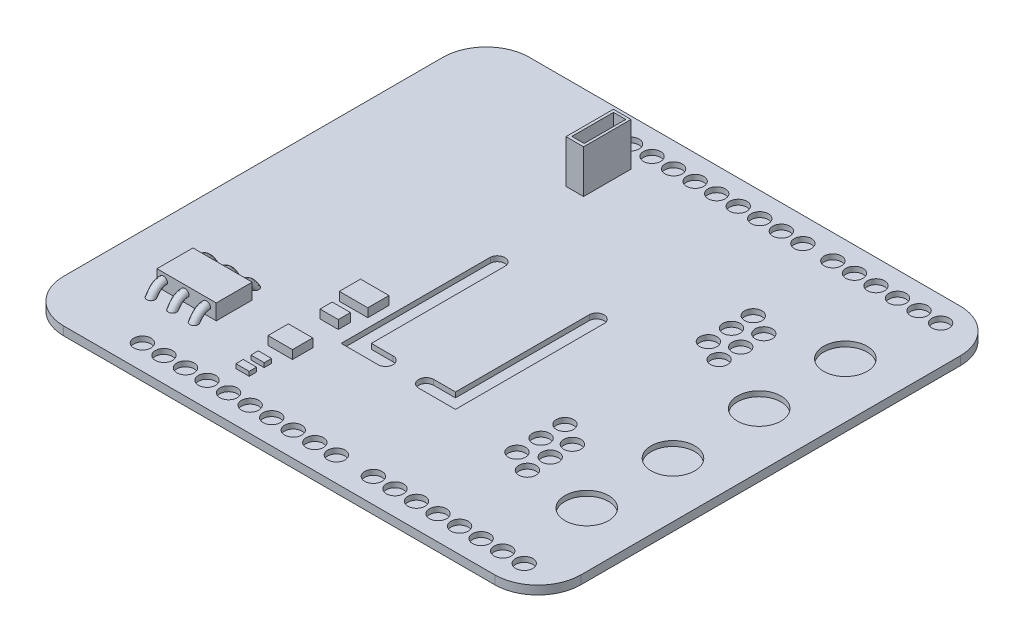
from build123d import *

# Parameters (mm, degrees)
BOSS_EXTRU_1_DEPTH                   = 1
ESQUISSE2_R                          = 1
ENL_V_MAT_EXTRU_1_DEPTH              = 0.6
R_P_TITION_LIN_AIRE1_COUNT           = 6
R_P_TITION_LIN_AIRE1_PITCH           = 2.5
ESQUISSE3_R                          = 1
ENL_V_MAT_EXTRU_2_DEPTH              = 0.6
R_P_TITION_LIN_AIRE2_COUNT           = 10
R_P_TITION_LIN_AIRE2_PITCH           = 2.5
ESQUISSE4_R                          = 1
ENL_V_MAT_EXTRU_3_DEPTH              = 0.6
R_P_TITION_LIN_AIRE3_COUNT           = 8
R_P_TITION_LIN_AIRE3_PITCH           = 2.5
ESQUISSE5_R                          = 1
ENL_V_MAT_EXTRU_4_DEPTH              = 0.6
R_P_TITION_LIN_AIRE4_COUNT           = 10
R_P_TITION_LIN_AIRE4_PITCH           = 2.5
ESQUISSE6_R                          = 2.528412427
ENL_V_MAT_EXTRU_5_DEPTH              = 0.6
R_P_TITION_LIN_AIRE5_COUNT           = 4
R_P_TITION_LIN_AIRE5_PITCH           = 10
ESQUISSE7_R                          = 1
ENL_V_MAT_EXTRU_6_DEPTH              = 0.6
ENL_V_MAT_EXTRU_7_DEPTH              = 0.6
ESQUISSE13_W                         = 2.040769276
ESQUISSE13_H                         = 5.500333113
BOSS_EXTRU_3_DEPTH                   = 5
ESQUISSE14_W                         = 1.424470163
ESQUISSE14_H                         = 4.828317201
ENL_V_MAT_EXTRU_9_DEPTH              = 3
ESQUISSE15_W                         = 6.877327247
ESQUISSE15_H                         = 4.174208242
BOSS_EXTRU_4_DEPTH                   = 1.8
ESQUISSE16_R                         = 0.483585673
R_P_TITION_LIN_AIRE6_COPY_1_SKETCH_R = 0.483585673
R_P_TITION_LIN_AIRE6_COPY_2_SKETCH_R = 0.483585673
R_P_TITION_LIN_AIRE6_COPY_3_SKETCH_R = 0.483585673
R_P_TITION_LIN_AIRE6_COPY_4_SKETCH_R = 0.483585673
ESQUISSE18_W                         = 1.537860489
ESQUISSE18_H                         = 0.85
ESQUISSE18_H_2                       = 0.847473853
BOSS_EXTRU_5_DEPTH                   = 0.5
ESQUISSE19_W                         = 2.827092101
ESQUISSE19_H                         = 2.356707552
BOSS_EXTRU_6_DEPTH                   = 1
ESQUISSE20_W                         = 2.113285246
ESQUISSE20_H                         = 1.410216863
ESQUISSE20_W_2                       = 3.299642183
ESQUISSE20_H_2                       = 2.46116146
BOSS_EXTRU_7_DEPTH                   = 1


with BuildPart() as part:
    # Esquisse1 → Boss.-Extru.1 (new body)
    with BuildSketch(Plane(origin=(0, 0, 0), x_dir=(1, 0, 0), z_dir=(0, 1, 0))):
        with BuildLine():
            Line((5, 0), (55, 0))
            ThreePointArc((55, 0), (58.535533906, 1.464466094), (60, 5))
            Line((60, 5), (60, 49))
            ThreePointArc((60, 49), (58.535533906, 52.535533906), (55, 54))
            Line((55, 54), (5, 54))
            ThreePointArc((5, 54), (1.464466094, 52.535533906), (0, 49))
            Line((0, 49), (0, 5))
            ThreePointArc((0, 5), (1.464466094, 1.464466094), (5, 0))
        make_face()
    extrude(amount=BOSS_EXTRU_1_DEPTH)

    # Esquisse2 → Enlèv. mat.-Extru.1 (cut)
    with BuildSketch(Plane(origin=(0, 1, 0), x_dir=(1, 0, 0), z_dir=(0, 1, 0))):
        with Locations((55.569344421, 51.151890883)):
            Circle(ESQUISSE2_R)
    enl_v_mat_extru_1 = extrude(amount=-ENL_V_MAT_EXTRU_1_DEPTH, mode=Mode.SUBTRACT)

    # Répétition linéaire1: Enlèv. mat.-Extru.1 ×6
    with Locations(*[(-i * R_P_TITION_LIN_AIRE1_PITCH, 0, 0) for i in range(1, R_P_TITION_LIN_AIRE1_COUNT)]):
        add(enl_v_mat_extru_1, mode=Mode.SUBTRACT)

    # Esquisse3 → Enlèv. mat.-Extru.2 (cut)
    with BuildSketch(Plane(origin=(0, 1, 0), x_dir=(1, 0, 0), z_dir=(0, 1, 0))):
        with Locations((39.592332451, 51.151890883)):
            Circle(ESQUISSE3_R)
    enl_v_mat_extru_2 = extrude(amount=-ENL_V_MAT_EXTRU_2_DEPTH, mode=Mode.SUBTRACT)

    # Répétition linéaire2: Enlèv. mat.-Extru.2 ×10
    with Locations(*[(-i * R_P_TITION_LIN_AIRE2_PITCH, 0, 0) for i in range(1, R_P_TITION_LIN_AIRE2_COUNT)]):
        add(enl_v_mat_extru_2, mode=Mode.SUBTRACT)

    # Esquisse4 → Enlèv. mat.-Extru.3 (cut)
    with BuildSketch(Plane(origin=(0, 1, 0), x_dir=(1, 0, 0), z_dir=(0, 1, 0))):
        with Locations((55.569344421, 2.85)):
            Circle(ESQUISSE4_R)
    enl_v_mat_extru_3 = extrude(amount=-ENL_V_MAT_EXTRU_3_DEPTH, mode=Mode.SUBTRACT)

    # Répétition linéaire3: Enlèv. mat.-Extru.3 ×8
    with Locations(*[(-i * R_P_TITION_LIN_AIRE3_PITCH, 0, 0) for i in range(1, R_P_TITION_LIN_AIRE3_COUNT)]):
        add(enl_v_mat_extru_3, mode=Mode.SUBTRACT)

    # Esquisse5 → Enlèv. mat.-Extru.4 (cut)
    with BuildSketch(Plane(origin=(0, 1, 0), x_dir=(1, 0, 0), z_dir=(0, 1, 0))):
        with Locations((33.773710205, 2.85)):
            Circle(ESQUISSE5_R)
    enl_v_mat_extru_4 = extrude(amount=-ENL_V_MAT_EXTRU_4_DEPTH, mode=Mode.SUBTRACT)

    # Répétition linéaire4: Enlèv. mat.-Extru.4 ×10
    with Locations(*[(-i * R_P_TITION_LIN_AIRE4_PITCH, 0, 0) for i in range(1, R_P_TITION_LIN_AIRE4_COUNT)]):
        add(enl_v_mat_extru_4, mode=Mode.SUBTRACT)

    # Esquisse6 → Enlèv. mat.-Extru.5 (cut)
    with BuildSketch(Plane(origin=(0, 1, 0), x_dir=(1, 0, 0), z_dir=(0, 1, 0))):
        with Locations((53.632308147, 42.041929073)):
            Circle(ESQUISSE6_R)
    enl_v_mat_extru_5 = extrude(amount=-ENL_V_MAT_EXTRU_5_DEPTH, mode=Mode.SUBTRACT)

    # Répétition linéaire5: Enlèv. mat.-Extru.5 ×4
    with Locations(*[(0, 0, i * R_P_TITION_LIN_AIRE5_PITCH) for i in range(1, R_P_TITION_LIN_AIRE5_COUNT)]):
        add(enl_v_mat_extru_5, mode=Mode.SUBTRACT)

    # Esquisse7 → Enlèv. mat.-Extru.6 (cut)
    with BuildSketch(Plane(origin=(0, 1, 0), x_dir=(1, 0, 0), z_dir=(0, 1, 0))):
        with Locations((46.386340384, 34.637074212)):
            Circle(ESQUISSE7_R)
        with Locations((46.386340384, 37.147617954)):
            Circle(ESQUISSE7_R)
        with Locations((46.386340384, 39.823952529)):
            Circle(ESQUISSE7_R)
        with Locations((43.964437523, 35.816934415)):
            Circle(ESQUISSE7_R)
        with Locations((43.964437523, 38.499793185)):
            Circle(ESQUISSE7_R)
        with Locations((43.964437523, 41.026771522)):
            Circle(ESQUISSE7_R)
        with Locations((46.386340384, 12.402326043)):
            Circle(ESQUISSE7_R)
        with Locations((46.386340384, 15.048719735)):
            Circle(ESQUISSE7_R)
        with Locations((46.386340384, 17.614919679)):
            Circle(ESQUISSE7_R)
        with Locations((43.964437523, 13.605232267)):
            Circle(ESQUISSE7_R)
        with Locations((43.964437523, 16.412013455)):
            Circle(ESQUISSE7_R)
        with Locations((43.964437523, 19.17869777)):
            Circle(ESQUISSE7_R)
    extrude(amount=-ENL_V_MAT_EXTRU_6_DEPTH, mode=Mode.SUBTRACT)

    # Esquisse8 → Enlèv. mat.-Extru.7 (cut)
    with BuildSketch(Plane(origin=(0, 1, 0), x_dir=(1, 0, 0), z_dir=(0, 1, 0))):
        with BuildLine():
            ThreePointArc((31.82326413, 16.095477991), (30.946694837, 15.218908698), (31.82326413, 14.342339405))
            Line((31.82326413, 14.342339405), (36.100922281, 14.342339405))
            Line((36.100922281, 14.342339405), (36.100922281, 31.66334864))
            ThreePointArc((36.100922281, 31.66334864), (35.224352988, 32.464971379), (34.347783695, 31.66334864))
            Line((34.347783695, 31.66334864), (34.347783695, 31.506448513))
            Line((34.347783695, 31.506448513), (34.347783695, 16.095477991))
            Line((34.347783695, 16.095477991), (31.82326413, 16.095477991))
        make_face()
    enl_v_mat_extru_7 = extrude(amount=-ENL_V_MAT_EXTRU_7_DEPTH, mode=Mode.SUBTRACT)

    # Symétrie1: Enlèv. mat.-Extru.7 across plane
    add(enl_v_mat_extru_7.mirror(Plane(origin=(29.468874111, 0, 0), x_dir=(0, 0, 1), z_dir=(1, 0, 0))), mode=Mode.SUBTRACT)

    # Esquisse13 → Boss.-Extru.3 (add)
    with BuildSketch(Plane(origin=(0, 1, 0), x_dir=(1, 0, 0), z_dir=(0, 1, 0))):
        with Locations((21.128639878, 45.903796258)):
            Rectangle(ESQUISSE13_W, ESQUISSE13_H)
    extrude(amount=BOSS_EXTRU_3_DEPTH)

    # Esquisse14 → Enlèv. mat.-Extru.9 (cut)
    with BuildSketch(Plane(origin=(0, 6, 0), x_dir=(1, 0, 0), z_dir=(0, 1, 0))):
        with Locations((21.138437589, 45.93458549)):
            Rectangle(ESQUISSE14_W, ESQUISSE14_H)
    extrude(amount=-ENL_V_MAT_EXTRU_9_DEPTH, mode=Mode.SUBTRACT)

    # Esquisse15 → Boss.-Extru.4 (add)
    with BuildSketch(Plane(origin=(0, 1, 0), x_dir=(1, 0, 0), z_dir=(0, 1, 0))):
        with Locations((9.88989293, 11.44925608)):
            Rectangle(ESQUISSE15_W, ESQUISSE15_H)
    extrude(amount=BOSS_EXTRU_4_DEPTH)

    # Balayage1: sweep along a path in Esquisse17
    with BuildLine() as balayage1_path:  # in the path sketch's own coordinates; laid on its plane below (add() does not lay a ready-made edge on the line's plane)
        add(Edge.make_bspline(
            [(-7.93754412, 1), (-8.696623506, 2.25897401), (-9.707943851, 1.941544376)],
            knots=[0, 0, 0, 1, 1, 1], degree=2))
    # Esquisse16 → Balayage1 (sweep)
    with BuildSketch(Plane(origin=(0, 1, 0), x_dir=(1, 0, 0), z_dir=(0, 1, 0))):
        with Locations((7.187086293, 7.93754412)):
            Circle(ESQUISSE16_R)
    balayage1 = sweep(path=Plane.ZY.offset(-7.187086293) * balayage1_path.line)

    # Symétrie2: Balayage1 across plane
    add(balayage1.mirror(Plane(origin=(0, 0, -11.44925608), x_dir=(1, 0, 0), z_dir=(0, 0, -1))))

    # Répétition linéaire6 copy 1: sweep along a path in Répétition linéaire6 copy 1 path
    with BuildLine() as r_p_tition_lin_aire6_copy_1_path:  # in the path sketch's own coordinates; laid on its plane below (add() does not lay a ready-made edge on the line's plane)
        add(Edge.make_bspline(
            [(-7.93754412, -1), (-8.696623506, -2.25897401), (-9.707943851, -1.941544376)],
            knots=[0, 0, 0, 1, 1, 1], degree=2))
    # Répétition linéaire6 copy 1 sketch → Répétition linéaire6 copy 1 (sweep)
    with BuildSketch(Plane(origin=(2.5, 1, -22.89851216), x_dir=(1, 0, 0), z_dir=(0, 1, 0))):
        with Locations((7.187086293, -7.93754412)):
            Circle(R_P_TITION_LIN_AIRE6_COPY_1_SKETCH_R)
    sweep(path=Plane(origin=(9.687086293, 0, -22.89851216), x_dir=(0, 0, -1), z_dir=(-1, 0, 0)) * r_p_tition_lin_aire6_copy_1_path.line)

    # Répétition linéaire6 copy 2: sweep along a path in Répétition linéaire6 copy 2 path
    with BuildLine() as r_p_tition_lin_aire6_copy_2_path:  # in the path sketch's own coordinates; laid on its plane below (add() does not lay a ready-made edge on the line's plane)
        add(Edge.make_bspline(
            [(-7.93754412, -1), (-8.696623506, -2.25897401), (-9.707943851, -1.941544376)],
            knots=[0, 0, 0, 1, 1, 1], degree=2))
    # Répétition linéaire6 copy 2 sketch → Répétition linéaire6 copy 2 (sweep)
    with BuildSketch(Plane(origin=(5, 1, -22.89851216), x_dir=(1, 0, 0), z_dir=(0, 1, 0))):
        with Locations((7.187086293, -7.93754412)):
            Circle(R_P_TITION_LIN_AIRE6_COPY_2_SKETCH_R)
    sweep(path=Plane(origin=(12.187086293, 0, -22.89851216), x_dir=(0, 0, -1), z_dir=(-1, 0, 0)) * r_p_tition_lin_aire6_copy_2_path.line)

    # Répétition linéaire6 copy 3: sweep along a path in Répétition linéaire6 copy 3 path
    with BuildLine() as r_p_tition_lin_aire6_copy_3_path:  # in the path sketch's own coordinates; laid on its plane below (add() does not lay a ready-made edge on the line's plane)
        add(Edge.make_bspline(
            [(-7.93754412, 1), (-8.696623506, 2.25897401), (-9.707943851, 1.941544376)],
            knots=[0, 0, 0, 1, 1, 1], degree=2))
    # Répétition linéaire6 copy 3 sketch → Répétition linéaire6 copy 3 (sweep)
    with BuildSketch(Plane(origin=(2.5, 1, 0), x_dir=(1, 0, 0), z_dir=(0, 1, 0))):
        with Locations((7.187086293, 7.93754412)):
            Circle(R_P_TITION_LIN_AIRE6_COPY_3_SKETCH_R)
    sweep(path=Plane.ZY.offset(-9.687086293) * r_p_tition_lin_aire6_copy_3_path.line)

    # Répétition linéaire6 copy 4: sweep along a path in Répétition linéaire6 copy 4 path
    with BuildLine() as r_p_tition_lin_aire6_copy_4_path:  # in the path sketch's own coordinates; laid on its plane below (add() does not lay a ready-made edge on the line's plane)
        add(Edge.make_bspline(
            [(-7.93754412, 1), (-8.696623506, 2.25897401), (-9.707943851, 1.941544376)],
            knots=[0, 0, 0, 1, 1, 1], degree=2))
    # Répétition linéaire6 copy 4 sketch → Répétition linéaire6 copy 4 (sweep)
    with BuildSketch(Plane(origin=(5, 1, 0), x_dir=(1, 0, 0), z_dir=(0, 1, 0))):
        with Locations((7.187086293, 7.93754412)):
            Circle(R_P_TITION_LIN_AIRE6_COPY_4_SKETCH_R)
    sweep(path=Plane.ZY.offset(-12.187086293) * r_p_tition_lin_aire6_copy_4_path.line)

    # Esquisse18 → Boss.-Extru.5 (add)
    with BuildSketch(Plane(origin=(0, 1, 0), x_dir=(1, 0, 0), z_dir=(0, 1, 0))):
        with Locations((20.044006751, 6.124660698)):
            Rectangle(ESQUISSE18_W, ESQUISSE18_H)
        with Locations((20.044006751, 7.8662652)):
            Rectangle(ESQUISSE18_W, ESQUISSE18_H_2)
    extrude(amount=BOSS_EXTRU_5_DEPTH)

    # Esquisse19 → Boss.-Extru.6 (add)
    with BuildSketch(Plane(origin=(0, 1, 0), x_dir=(1, 0, 0), z_dir=(0, 1, 0))):
        with Locations((20.225394797, 11.06931639)):
            Rectangle(ESQUISSE19_W, ESQUISSE19_H)
    extrude(amount=BOSS_EXTRU_6_DEPTH)

    # Esquisse20 → Boss.-Extru.7 (add)
    with BuildSketch(Plane(origin=(0, 1, 0), x_dir=(1, 0, 0), z_dir=(0, 1, 0))):
        with Locations((20.221371034, 16.274708187)):
            Rectangle(ESQUISSE20_W, ESQUISSE20_H)
        with Locations((20.153348609, 19.694535559)):
            Rectangle(ESQUISSE20_W_2, ESQUISSE20_H_2)
    extrude(amount=BOSS_EXTRU_7_DEPTH)


solid = part.part
